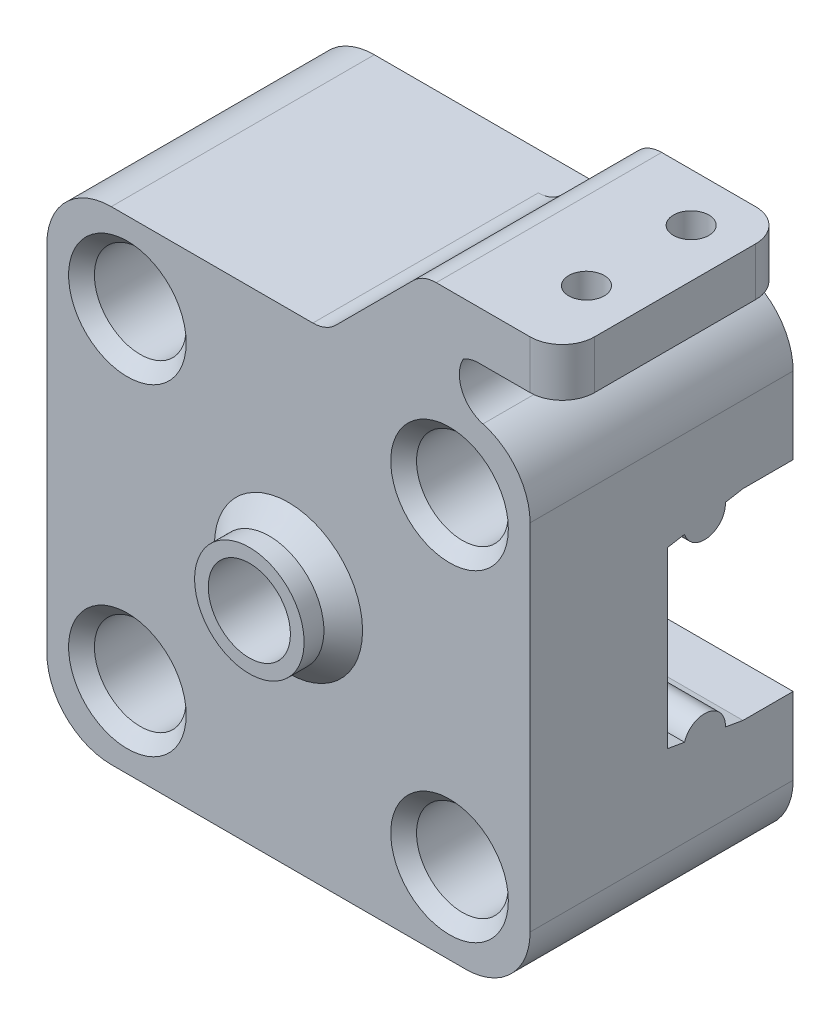
from build123d import *

# Parameters (mm, degrees)
SKETCH1_W                  = 30
SKETCH1_H                  = 30
SKETCH1_R                  = 1.6
SKETCH1_W_2                = 81.01
SKETCH1_H_2                = 12
BOSS_EXTRUDE1_DEPTH        = 6
SKETCH1_3_W                = 30
SKETCH1_3_H                = 30
SKETCH1_3_R                = 1.6
BOSS_EXTRUDE2_DEPTH        = 22.33
CUT_EXTRUDE1_DEPTH         = 88.671255266
SKETCH3_R                  = 2.55
CUT_EXTRUDE2_DEPTH         = 8
CUT_EXTRUDE3_DEPTH         = 4.5
SKETCH6_R                  = 5
CUT_EXTRUDE5_DEPTH         = 8.6
SKETCH7_R                  = 1.6
CUT_EXTRUDE6_DEPTH         = 112.183402538
SKETCH8_R                  = 2.85
CUT_EXTRUDE7_DEPTH         = 11
BOSS_EXTRUDE3_START        = 2.43
SKETCH9_R                  = 3.4
SKETCH9_R_2                = 2.55
BOSS_EXTRUDE3_DEPTH        = 2.43
CHAMFER1_SIZE              = 1.2
FILLET3_R                  = 4
CHAMFER2_SIZE              = 0.8
BOSS_EXTRUDE6_DEPTH        = 14
CUT_EXTRUDE10_REACH        = 116.661
SKETCH17_R                 = 1.1
FILLET5_R                  = 2
CUT_EXTRUDE11_DEPTH        = 3
CHAMFER3_SIZE              = 0.8
LPATTERN2_COUNT            = 3
LPATTERN2_PITCH            = 25
CHAMFER3_OF_LPATTERN2_SIZE = 0.8
SKETCH18_W                 = 122.175107863
SKETCH18_H                 = 35.769473483
CUT_EXTRUDE12_DEPTH        = 6


with BuildPart() as part:
    # Sketch1 → Boss-Extrude1 (new body)
    # profile 1 of 2: a face of its own
    with BuildSketch(Plane.XY):
        with Locations((10, 10)):
            Rectangle(SKETCH1_W, SKETCH1_H)
        with Locations((20, 0)):
            Circle(SKETCH1_R, mode=Mode.SUBTRACT)
        with Locations((20, 20)):
            Circle(SKETCH1_R, mode=Mode.SUBTRACT)
        with Locations((0, 20)):
            Circle(SKETCH1_R, mode=Mode.SUBTRACT)
        Circle(SKETCH1_R, mode=Mode.SUBTRACT)
    # profile 2 of 2: a face of its own
    with BuildSketch(Plane.XY):
        with Locations((65.505, 10)):
            Rectangle(SKETCH1_W_2, SKETCH1_H_2)
    extrude(amount=BOSS_EXTRUDE1_DEPTH)

    # Sketch1<3> → Boss-Extrude2 (add)
    with BuildSketch(Plane.XY):
        with Locations((10, 10)):
            Rectangle(SKETCH1_3_W, SKETCH1_3_H)
        with Locations((20, 0)):
            Circle(SKETCH1_3_R, mode=Mode.SUBTRACT)
        with Locations((20, 20)):
            Circle(SKETCH1_3_R, mode=Mode.SUBTRACT)
        with Locations((0, 20)):
            Circle(SKETCH1_3_R, mode=Mode.SUBTRACT)
        Circle(SKETCH1_3_R, mode=Mode.SUBTRACT)
    extrude(amount=BOSS_EXTRUDE2_DEPTH)

    # Sketch2 → Cut-Extrude1 (cut, through all)
    with BuildSketch(Plane(origin=(25, 0, 0), x_dir=(0, 0, -1), z_dir=(1, 0, 0))):
        with BuildLine():
            Line((-6.517643056, 16.229072043), (-9.113243056, 16.229072043))
            Line((-9.113243056, 16.229072043), (-10.205127296, 16.036543391))
            ThreePointArc((-10.205127296, 16.036543391), (-11.275834451, 14.691428541), (-12.742026437, 15.589219625))
            Line((-12.742026437, 15.589219625), (-13.785323056, 15.405258283))
            Line((-13.785323056, 15.405258283), (-13.785323056, 4.594005803))
            Line((-13.785323056, 4.594005803), (-12.742026437, 4.41004446))
            ThreePointArc((-12.742026437, 4.41004446), (-11.275834451, 5.307835545), (-10.205127296, 3.962720694))
            Line((-10.205127296, 3.962720694), (-9.113243056, 3.770192043))
            Line((-9.113243056, 3.770192043), (-6.517643056, 3.770192043))
            Line((-6.517643056, 3.770192043), (-5.963076397, 3.770192043))
            Line((-5.963076397, 3.770192043), (-5.963076397, 16.229072043))
            Line((-5.963076397, 16.229072043), (-6.517643056, 16.229072043))
        make_face()
    extrude(amount=-CUT_EXTRUDE1_DEPTH, mode=Mode.SUBTRACT)

    # Sketch3 → Cut-Extrude2 (cut)
    with BuildSketch(Plane.XY.offset(22.33)):
        with Locations((10, 10)):
            Circle(SKETCH3_R)
    extrude(amount=-CUT_EXTRUDE2_DEPTH, mode=Mode.SUBTRACT)

    # Sketch5 → Cut-Extrude3 (cut)
    with BuildSketch(Plane(origin=(0, 0, 13.785323056), x_dir=(-1, 0, 0), z_dir=(0, 0, -1))):
        Polygon((-5.32346282, 10), (-7.66173141, 14.05), (-12.33826859, 14.05), (-14.67653718, 10), (-12.33826859, 5.95), (-7.66173141, 5.95), align=None)
    extrude(amount=-CUT_EXTRUDE3_DEPTH, mode=Mode.SUBTRACT)

    # Sketch6 → Cut-Extrude5 (cut)
    with BuildSketch(Plane(origin=(0, 0, 0), x_dir=(-1, 0, 0), z_dir=(0, 0, -1))):
        with Locations((-10, 10)):
            Circle(SKETCH6_R)
    extrude(amount=-CUT_EXTRUDE5_DEPTH, mode=Mode.SUBTRACT)

    # Sketch7 → Cut-Extrude6 (cut, through all)
    with BuildSketch(Plane(origin=(0, 0, 0), x_dir=(-1, 0, 0), z_dir=(0, 0, -1))):
        with BuildLine():
            ThreePointArc((-101.1, 10), (-99.5, 8.4), (-97.9, 10))
            Line((-97.9, 10), (-101.1, 10))
        make_face()
        with BuildLine():
            Line((-101.1, 10), (-97.9, 10))
            ThreePointArc((-97.9, 10), (-99.5, 11.6), (-101.1, 10))
        make_face()
        with Locations((-74.5, 10)):
            Circle(SKETCH7_R)
        with Locations((-49.5, 10)):
            Circle(SKETCH7_R)
    extrude(amount=-CUT_EXTRUDE6_DEPTH, mode=Mode.SUBTRACT)

    # Sketch8 → Cut-Extrude7 (cut)
    with BuildSketch(Plane.XY.offset(22.33)):
        with Locations((20, 20)):
            Circle(SKETCH8_R)
        with Locations((20, 0)):
            Circle(SKETCH8_R)
        Circle(SKETCH8_R)
        with Locations((0, 20)):
            Circle(SKETCH8_R)
    extrude(amount=-CUT_EXTRUDE7_DEPTH, mode=Mode.SUBTRACT)

    # Sketch9 → Boss-Extrude3 (add)
    with BuildSketch(Plane.XY.offset(22.33).offset(BOSS_EXTRUDE3_START)):
        with Locations(Location((10, 10, 0), (0, 0, 180))):
            Circle(SKETCH9_R)
        with Locations((10, 10)):
            Circle(SKETCH9_R_2, mode=Mode.SUBTRACT)
    extrude(amount=-BOSS_EXTRUDE3_DEPTH)

    # Chamfer1
    chamfer1_edges = [part.edges().sort_by_distance(p)[0] for p in [
        (13.4, 10, 22.33),
    ]]
    chamfer(chamfer1_edges, length=CHAMFER1_SIZE)

    # Fillet3
    # the kernel refuses this fillet: 4 mm, written as the material it adds along each edge
    with BuildSketch(Plane(origin=(25, 4, 0), x_dir=(0, -1, 0), z_dir=(0, 0, 1))) as fillet3_piece_1:
        with BuildLine():
            CenterArc((FILLET3_R, FILLET3_R), FILLET3_R, 180, 90)
            Line((0, FILLET3_R), (0, 0))
            Line((0, 0), (FILLET3_R, 0))
        make_face()
    extrude(amount=5.963076397)
    with BuildSketch(Plane(origin=(25, 16, 0), x_dir=(0, 1, 0), z_dir=(0, 0, 1))) as fillet3_piece_2:
        with BuildLine():
            CenterArc((FILLET3_R, -FILLET3_R), FILLET3_R, 90, 90)
            Line((0, -FILLET3_R), (0, 0))
            Line((0, 0), (FILLET3_R, 0))
        make_face()
    extrude(amount=5.963076397)
    # the kernel refuses this fillet: 4 mm, written as the material it takes off along each edge
    with BuildSketch(Plane(origin=(-5, -5, 32.33), x_dir=(1, 0, 0), z_dir=(0, 0, -1)), Plane(origin=(-5, 25, 32.33), x_dir=(0, -1, 0), z_dir=(0, 0, -1)), Plane(origin=(25, 25, -10), x_dir=(0, -1, 0), z_dir=(0, 0, 1)), Plane(origin=(25, -5, -10), x_dir=(-1, 0, 0), z_dir=(0, 0, 1))) as fillet3_2_piece_1:
        with BuildLine():
            CenterArc((FILLET3_R, -FILLET3_R), FILLET3_R, 90, 90)
            Line((0, -FILLET3_R), (0, 0))
            Line((0, 0), (FILLET3_R, 0))
        make_face()
    extrude(amount=42.33, mode=Mode.SUBTRACT)
    with BuildSketch(Plane(origin=(106.01, 16, -10), x_dir=(-1, 0, 0), z_dir=(0, 0, 1))) as fillet3_2_piece_2:
        with BuildLine():
            CenterArc((FILLET3_R, FILLET3_R), FILLET3_R, 180, 90)
            Line((0, FILLET3_R), (0, 0))
            Line((0, 0), (FILLET3_R, 0))
        make_face()
    extrude(amount=26, mode=Mode.SUBTRACT)
    with BuildSketch(Plane(origin=(106.01, 4, -10), x_dir=(-1, 0, 0), z_dir=(0, 0, 1))) as fillet3_2_piece_3:
        with BuildLine():
            CenterArc((FILLET3_R, -FILLET3_R), FILLET3_R, 90, 90)
            Line((0, -FILLET3_R), (0, 0))
            Line((0, 0), (FILLET3_R, 0))
        make_face()
    extrude(amount=26, mode=Mode.SUBTRACT)

    # Chamfer2
    chamfer2_edges = [part.edges().sort_by_distance(p)[0] for p in [
        (-2.85, 20, 22.33),
        (-2.85, 0, 22.33),
        (17.15, 0, 22.33),
        (17.15, 20, 22.33),
    ]]
    chamfer(chamfer2_edges, length=CHAMFER2_SIZE)

    # Sketch15 → Boss-Extrude6 (add)
    with BuildSketch(Plane.XY.offset(22.33)):
        Polygon((18.343145751, 31), (12.343145751, 25), (18, 25), (21, 28), (27, 28), (27, 31), align=None)
    extrude(amount=-BOSS_EXTRUDE6_DEPTH)

    # Sketch17 → Cut-Extrude10 (cut, up to next)
    with BuildSketch(Plane(origin=(0, 31, 0), x_dir=(1, 0, 0), z_dir=(0, 1, 0)), mode=Mode.PRIVATE) as cut_extrude10_sk1:
        with Locations(Location((24, -11.33, 0), (0, 0, 180))):
            Circle(SKETCH17_R)
    cut_extrude10_tool1 = extrude(cut_extrude10_sk1.sketch, amount=-CUT_EXTRUDE10_REACH, mode=Mode.PRIVATE) & part.part
    # Sketch17 → Cut-Extrude10 (cut, up to next)
    with BuildSketch(Plane(origin=(0, 31, 0), x_dir=(1, 0, 0), z_dir=(0, 1, 0)), mode=Mode.PRIVATE) as cut_extrude10_sk2:
        with Locations(Location((24, -17.83, 0), (0, 0, 180))):
            Circle(SKETCH17_R)
    cut_extrude10_tool2 = extrude(cut_extrude10_sk2.sketch, amount=-CUT_EXTRUDE10_REACH, mode=Mode.PRIVATE) & part.part
    add(cut_extrude10_tool1.solids().sort_by_distance((24, 31, 11.33))[0], mode=Mode.SUBTRACT)
    add(cut_extrude10_tool2.solids().sort_by_distance((24, 31, 17.83))[0], mode=Mode.SUBTRACT)

    # Fillet5
    # the kernel refuses this fillet: 2 mm, written as the material it adds along each edge
    with BuildSketch(Plane(origin=(21, 28, 22.33), x_dir=(-0.7071067811865475, -0.7071067811865475, 0), z_dir=(0, 0, -1))) as fillet5_piece_1:
        with BuildLine():
            CenterArc((FILLET5_R * 0.414213562373, -FILLET5_R), FILLET5_R, 90, 45)
            Line((-FILLET5_R * 0.292893218813, -FILLET5_R * 0.292893218813), (0, 0))
            Line((0, 0), (FILLET5_R * 0.414213562373, 0))
        make_face()
    extrude(amount=14)
    with BuildSketch(Plane(origin=(12.343145751, 25, 22.33), x_dir=(-1, 0, 0), z_dir=(0, 0, -1))) as fillet5_piece_2:
        with BuildLine():
            CenterArc((FILLET5_R * 0.414213562373, FILLET5_R), FILLET5_R, 225, 45)
            Line((-FILLET5_R * 0.292893218813, FILLET5_R * 0.292893218813), (0, 0))
            Line((0, 0), (FILLET5_R * 0.414213562373, 0))
        make_face()
    extrude(amount=14)
    with BuildSketch(Plane(origin=(18, 25, 22.33), x_dir=(0.9993539414176275, -0.035940225000035846, 0), z_dir=(0, 0, -1))) as fillet5_piece_3:
        with BuildLine():
            CenterArc((4.541773641, -1.944797545), FILLET5_R, 103.492916805, 119.447416414)
            Line((3.07764659, -3.307270289), (2.931233885, -3.443517564))
            Line((2.931233885, -3.443517564), (-0.146412705, -0.136247274))
            Line((-0.146412705, -0.136247274), (0.007188045, 0.199870788))
            ThreePointArc((0.007188045, 0.199870788), (3.005249869, 0.092050113), (4.028458305, 0.194479755))
            Line((4.028458305, 0.194479755), (4.075123335, 0))
        make_face()
    extrude(amount=14)
    # the kernel refuses this fillet: 2 mm, written as the material it takes off along each edge
    with BuildSketch(Plane(origin=(27, 23, 22.33), x_dir=(-1, 0, 0), z_dir=(0, 1, 0))) as fillet5_2_piece_1:
        with BuildLine():
            CenterArc((FILLET5_R, -FILLET5_R), FILLET5_R, 90, 90)
            Line((0, -FILLET5_R), (0, 0))
            Line((0, 0), (FILLET5_R, 0))
        make_face()
    extrude(amount=13, mode=Mode.SUBTRACT)
    with BuildSketch(Plane(origin=(27, 23, 8.33), x_dir=(-1, 0, 0), z_dir=(0, 1, 0))) as fillet5_2_piece_2:
        with BuildLine():
            CenterArc((FILLET5_R, FILLET5_R), FILLET5_R, 180, 90)
            Line((0, FILLET5_R), (0, 0))
            Line((0, 0), (FILLET5_R, 0))
        make_face()
    extrude(amount=13, mode=Mode.SUBTRACT)
    with BuildSketch(Plane(origin=(18.343145751, 31, 24.401067812), x_dir=(-0.7071067811865476, -0.7071067811865476, 0), z_dir=(0, 0, -1))) as fillet5_2_piece_3:
        with BuildLine():
            CenterArc((FILLET5_R * 0.414213562373, -FILLET5_R), FILLET5_R, 90, 45)
            Line((-FILLET5_R * 0.292893218813, -FILLET5_R * 0.292893218813), (0, 0))
            Line((0, 0), (FILLET5_R * 0.414213562373, 0))
        make_face()
    extrude(amount=18.142135624, mode=Mode.SUBTRACT)

    # Sketch10 → Cut-Extrude11 (cut)
    with BuildSketch(Plane(origin=(0, 0, 0), x_dir=(-1, 0, 0), z_dir=(0, 0, -1))):
        Polygon((-97.883419246, 12.8), (-101.116580754, 12.8), (-102.733161507, 10), (-101.116580754, 7.2), (-97.883419246, 7.2), (-96.266838493, 10), align=None)
    cut_extrude11 = extrude(amount=-CUT_EXTRUDE11_DEPTH, mode=Mode.SUBTRACT)

    # Chamfer3
    chamfer3_edges = [part.edges().sort_by_distance(p)[0] for p in [
        (97.075128869, 11.4, 0),
        (99.5, 12.8, 0),
        (101.924871131, 11.4, 0),
        (101.924871131, 8.6, 0),
        (99.5, 7.2, 0),
        (97.075128869, 8.6, 0),
    ]]
    chamfer(chamfer3_edges, length=CHAMFER3_SIZE)

    # LPattern2: Cut-Extrude11 ×3
    with Locations(*[(-i * LPATTERN2_PITCH, 0, 0) for i in range(1, LPATTERN2_COUNT)]):
        add(cut_extrude11, mode=Mode.SUBTRACT)

    # Chamfer3 of LPattern2
    chamfer3_of_lpattern2_edges = [part.edges().sort_by_distance(p)[0] for p in [
        (72.075128869, 11.4, 0),
        (74.5, 12.8, 0),
        (76.924871131, 11.4, 0),
        (76.924871131, 8.6, 0),
        (74.5, 7.2, 0),
        (72.075128869, 8.6, 0),
        (47.075128869, 11.4, 0),
        (49.5, 12.8, 0),
        (51.924871131, 11.4, 0),
        (51.924871131, 8.6, 0),
        (49.5, 7.2, 0),
        (47.075128869, 8.6, 0),
    ]]
    chamfer(chamfer3_of_lpattern2_edges, length=CHAMFER3_OF_LPATTERN2_SIZE)

    # Sketch18 → Cut-Extrude12 (cut)
    with BuildSketch(Plane(origin=(0, 0, 0), x_dir=(-1, 0, 0), z_dir=(0, 0, -1))):
        with Locations((-52.349363477, 8.808264827)):
            Rectangle(SKETCH18_W, SKETCH18_H)
    extrude(amount=-CUT_EXTRUDE12_DEPTH, mode=Mode.SUBTRACT)


solid = part.part
